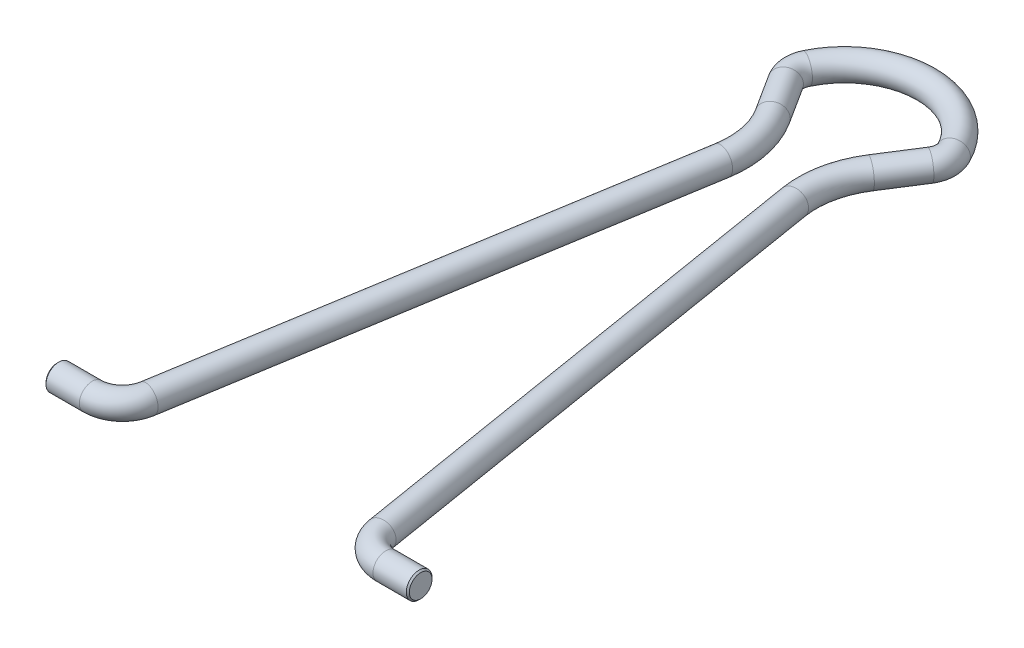
from build123d import *

# Parameters (mm, degrees)
SKETCH2_R     = 0.85
CHAMFER1_SIZE = 0.1


with BuildPart() as part:
    # Sweep2: sweep along a path in Sketch1
    with BuildLine(Plane(origin=(0, 0, 0), x_dir=(1, 0, 0), z_dir=(0, 1, 0))) as sweep2_path:
        Line((-12, -40), (-9.698387528, -40))
        ThreePointArc((-9.698387528, -40), (-8.403804383, -39.524484988), (-7.724814957, -38.324054479))
        Line((-7.724814957, -38.324054479), (-2.371685824, -5.722163438))
        ThreePointArc((-2.371685824, -5.722163438), (-2.41492462, -3.543666064), (-3.233291931, -1.524261364))
        Line((-3.233291931, -1.524261364), (-4.764777902, 0.87765625))
        ThreePointArc((-4.764777902, 0.87765625), (-4.997339075, 1.594784166), (-4.851667642, 2.334471248))
        ThreePointArc((-4.851667642, 2.334471248), (0, 5.384090909), (4.851667642, 2.334471248))
        ThreePointArc((4.851667642, 2.334471248), (4.997339075, 1.594784166), (4.764777902, 0.87765625))
        Line((4.764777902, 0.87765625), (3.233291931, -1.524261364))
        ThreePointArc((3.233291931, -1.524261364), (2.41492462, -3.543666064), (2.371685824, -5.722163438))
        Line((2.371685824, -5.722163438), (7.724814957, -38.324054479))
        ThreePointArc((7.724814957, -38.324054479), (8.403804383, -39.524484988), (9.698387528, -40))
        Line((9.698387528, -40), (12, -40))
    # Sketch2 → Sweep2 (sweep)
    with BuildSketch(Plane(origin=(-12, 0, 40), x_dir=(0, 0, 1), z_dir=(-1, 0, 0))):
        Circle(SKETCH2_R)
    sweep(path=sweep2_path.line)

    # Chamfer1
    chamfer1_edges = [part.edges().sort_by_distance(p)[0] for p in [
        (-12, 0, 39.15),
        (12, 0, 39.15),
    ]]
    chamfer(chamfer1_edges, length=CHAMFER1_SIZE)


solid = part.part
